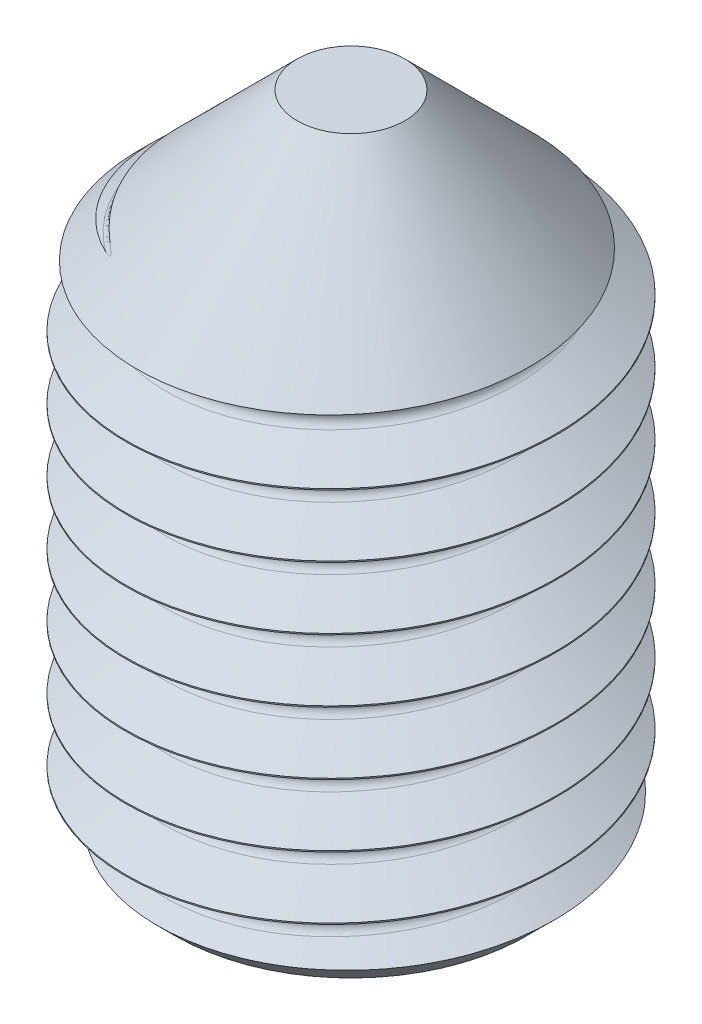
from build123d import *

# Parameters (mm, degrees)
SKETCH1_R           = 6
BOSS_EXTRUDE1_DEPTH = 9
CUT_EXTRUDE1_DEPTH  = 5.5
CUT_SWEEP1_PITCH    = 1.75


with BuildPart() as part:
    # Sketch1 → Boss-Extrude1 (new, symmetric)
    with BuildSketch(Plane(origin=(0, 0, 0), x_dir=(1, 0, 0), z_dir=(0, 1, 0))):
        with Locations(Location((0, 0, 0), (0, 0, 270))):
            Circle(SKETCH1_R)
    extrude(amount=BOSS_EXTRUDE1_DEPTH, both=True)

    # Sketch2 → Cut-Revolve1 (revolve, cut)
    with BuildSketch(Plane.XY, mode=Mode.PRIVATE) as cut_revolve1_sk:
        Polygon((1.5, 9), (9.75821077, 0.74178923), (9.75821077, -4.14178923), (4.9, -9), (4.9, -11.440460971), (12.471352994, -11.440460971), (12.471352994, 12.204396091), (1.5, 12.204396091), align=None)
    revolve(cut_revolve1_sk.sketch.rotate(Axis((0, 0, 0), (0, -1, 0)), 270), axis=Axis((0, 0, 0), (0, -1, 0)), mode=Mode.SUBTRACT)

    # Sketch3 → Cut-Extrude1 (cut)
    with BuildSketch(Plane.XZ.offset(9)):
        Polygon((3.07, -1.772465326), (3.07, 1.772465326), (0, 3.544930653), (-3.07, 1.772465326), (-3.07, -1.772465326), (0, -3.544930653), align=None)
    extrude(amount=-CUT_EXTRUDE1_DEPTH, mode=Mode.SUBTRACT)

    # Cut-Sweep1: the profile of Sketch5 screwed along a right-hand helix of 14.5 turns, 10 arcs to a turn; built about Z, then put on its axis
    cut_sweep1_z = Axis((0, 0, 0), (0, 0, 1))
    cut_sweep1_corners = [(-6.029089608, 0, 0.564315051), (-4.892419254, 0, -0.091941884), (-4.766156754, 0, -0.310634949), (-4.892419254, 0, -0.529328014), (-6.029089608, 0, -1.185584949)]
    with BuildLine(mode=Mode.PRIVATE) as cut_sweep1_profile:
        Line(cut_sweep1_corners[0], cut_sweep1_corners[1])
        Line(cut_sweep1_corners[3], cut_sweep1_corners[4])
        Line(cut_sweep1_corners[4], cut_sweep1_corners[0])
        ThreePointArc((-4.892419254, 0, -0.091941884), (-4.799988689, 0, -0.184372449), (-4.766156754, 0, -0.310634949))
        ThreePointArc((-4.766156754, 0, -0.310634949), (-4.799988689, 0, -0.436897449), (-4.892419254, 0, -0.529328014))
    cut_sweep1_cap = Face(cut_sweep1_profile.wire())
    cut_sweep1_arcs = [((-4.892419254, 0, -0.091941884), (-4.766156754, 0, -0.164839573), (-4.766156754, 0, -0.310634949), (1, 0.8660254037844365, 1)), ((-4.766156754, 0, -0.310634949), (-4.766156754, 0, -0.456430326), (-4.892419254, 0, -0.529328014), (1, 0.8660254037844365, 1))]  # start, shoulder, end, weights
    cut_sweep1_turn_angles = [0, 18, 36, 54, 72, 90, 108, 126, 144, 162, 180, 198, 216, 234, 252, 270, 288, 306, 324, 342, 360]
    cut_sweep1_turn_weights = [1, 0.9510565162951535, 1, 0.9510565162951535, 1, 0.9510565162951535, 1, 0.9510565162951535, 1, 0.9510565162951535, 1, 0.9510565162951535, 1, 0.9510565162951535, 1, 0.9510565162951535, 1, 0.9510565162951535, 1, 0.9510565162951535, 1]
    cut_sweep1_turn_rails = [Edge.make_bspline([Vector(p[0], p[1], 0).rotate(cut_sweep1_z, cut_sweep1_turn_angles[k]) / cut_sweep1_turn_weights[k] + Vector(0, 0, p[2] + CUT_SWEEP1_PITCH * cut_sweep1_turn_angles[k] / 360) for k in range(21)], [0, 0, 0, 1, 1, 2, 2, 3, 3, 4, 4, 5, 5, 6, 6, 7, 7, 8, 8, 9, 9, 10, 10, 10], 2, cut_sweep1_turn_weights) for p in cut_sweep1_corners]
    cut_sweep1_turn_sides = [*[Face.make_surface_from_curves(cut_sweep1_turn_rails[p[0]], cut_sweep1_turn_rails[p[1]]) for p in [(0, 1), (3, 4), (4, 0)]], *[Face.make_bezier_surface([[Vector(p[j][0], p[j][1], 0).rotate(cut_sweep1_z, cut_sweep1_turn_angles[2 * i + k]) / cut_sweep1_turn_weights[2 * i + k] + Vector(0, 0, p[j][2] + CUT_SWEEP1_PITCH * cut_sweep1_turn_angles[2 * i + k] / 360) for k in range(3)] for j in range(3)], [[p[3][j] * cut_sweep1_turn_weights[2 * i + k] for k in range(3)] for j in range(3)]) for p in cut_sweep1_arcs for i in range(10)]]
    cut_sweep1_last_angles = [5040, 5058, 5076, 5094, 5112, 5130, 5148, 5166, 5184, 5202, 5220]
    cut_sweep1_last_weights = [1, 0.9510565162951535, 1, 0.9510565162951535, 1, 0.9510565162951535, 1, 0.9510565162951535, 1, 0.9510565162950971, 1]
    cut_sweep1_last_rails = [Edge.make_bspline([Vector(p[0], p[1], 0).rotate(cut_sweep1_z, cut_sweep1_last_angles[k]) / cut_sweep1_last_weights[k] + Vector(0, 0, p[2] + CUT_SWEEP1_PITCH * cut_sweep1_last_angles[k] / 360) for k in range(11)], [0, 0, 0, 1, 1, 2, 2, 3, 3, 4, 4, 5, 5, 5], 2, cut_sweep1_last_weights) for p in cut_sweep1_corners]
    cut_sweep1_last_sides = [*[Face.make_surface_from_curves(cut_sweep1_last_rails[p[0]], cut_sweep1_last_rails[p[1]]) for p in [(0, 1), (3, 4), (4, 0)]], *[Face.make_bezier_surface([[Vector(p[j][0], p[j][1], 0).rotate(cut_sweep1_z, cut_sweep1_last_angles[2 * i + k]) / cut_sweep1_last_weights[2 * i + k] + Vector(0, 0, p[j][2] + CUT_SWEEP1_PITCH * cut_sweep1_last_angles[2 * i + k] / 360) for k in range(3)] for j in range(3)], [[p[3][j] * cut_sweep1_last_weights[2 * i + k] for k in range(3)] for j in range(3)]) for p in cut_sweep1_arcs for i in range(5)]]
    cut_sweep1 = Plane(origin=(0, -9, 0), x_dir=(-1, 0, 0), z_dir=(0, 1, 0)) * Solid(Shell([*[p.moved(Location((0, 0, CUT_SWEEP1_PITCH * i))) for i in range(14) for p in cut_sweep1_turn_sides], *cut_sweep1_last_sides, cut_sweep1_cap, cut_sweep1_cap.rotate(cut_sweep1_z, 5220).moved(Location((0, 0, CUT_SWEEP1_PITCH * 5220 / 360)))]))
    add(cut_sweep1, mode=Mode.SUBTRACT)

    # Cut-Extrude2 cone 1 section (through the dimple's axis) → Cut-Extrude2 (revolve, cut)
    with BuildSketch(Plane(origin=(0, -9, 0), x_dir=(0, 0, -1), z_dir=(1, 0, 0))):
        Polygon((0, 0), (3.544930653, 0), (0, 0.949861306), align=None)
    revolve(axis=Axis((0, -9, 0), (0, 1, 0)), mode=Mode.SUBTRACT)


solid = part.part
